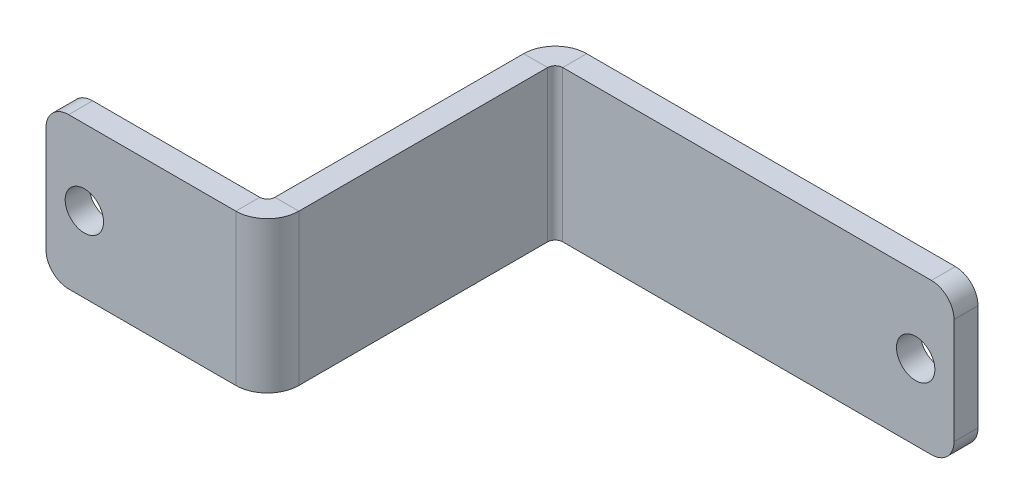
from build123d import *

# Parameters (mm, degrees)
SKETCH1_W                    = 26.140328994
SKETCH1_H                    = 20
BASE_FLANGE1_DEPTH           = 3.175
EDGE_FLANGE1_STRIP_W         = 14.7
EDGE_FLANGE1_STRIP_H         = 3.175
EDGE_FLANGE1_STRIP_CUT_DEPTH = 20
EDGE_FLANGE1_DEPTH           = 20
EDGE_FLANGE2_STRIP_W         = 14.7
EDGE_FLANGE2_STRIP_H         = 3.175
EDGE_FLANGE2_STRIP_CUT_DEPTH = 20
EDGE_FLANGE2_DEPTH           = 20
FILLET1_R                    = 3
SKETCH18_R                   = 2.54
CUT_EXTRUDE2_DEPTH           = 360.816616057
SKETCH19_R                   = 2.54
CUT_EXTRUDE3_DEPTH           = 360.466065193


# Sheet-metal steps are written as plain solids
with BuildPart() as part:
    # Sketch1 → Base-Flange1 (new body)
    with BuildSketch(Plane.XY.offset(-1949.683434301)):
        with Locations((87.899449082, 311.128054742)):
            Rectangle(SKETCH1_W, SKETCH1_H)
    extrude(amount=BASE_FLANGE1_DEPTH)

    # Edge-Flange1 strip (across the edge) → Edge-Flange1 strip cut (cut)
    with BuildSketch(Plane(origin=(100.969613579, 321.128054742, -1949.683434301), x_dir=(-1, 0, 0), z_dir=(0, -1, 0))):
        with Locations((-6.35, -1.5875)):
            Rectangle(EDGE_FLANGE1_STRIP_W, EDGE_FLANGE1_STRIP_H)
    extrude(amount=EDGE_FLANGE1_STRIP_CUT_DEPTH, mode=Mode.SUBTRACT)

    # Edge-Flange1 section (across the edge) → Edge-Flange1 (add)
    with BuildSketch(Plane(origin=(100.969613579, 321.128054742, -1949.683434301), x_dir=(-1, 0, 0), z_dir=(0, -1, 0))):
        with BuildLine():
            Line((-3.175, 1), (-3.175, 34.9454))
            Line((-3.175, 34.9454), (0, 34.9454))
            Line((0, 34.9454), (0, 1))
            ThreePointArc((0, 1), (0.292893219, 0.292893219), (1, 0))
            Line((1, 0), (1, -3.175))
            ThreePointArc((1, -3.175), (-1.952170811, -1.952170811), (-3.175, 1))
        make_face()
    extrude(amount=EDGE_FLANGE1_DEPTH)

    # Edge-Flange2 strip (across the edge) → Edge-Flange2 strip cut (cut)
    with BuildSketch(Plane(origin=(104.144613579, 301.128054742, -1984.628834301), x_dir=(0, 0, 1), z_dir=(0, 1, 0))):
        with Locations((-6.35, -1.5875)):
            Rectangle(EDGE_FLANGE2_STRIP_W, EDGE_FLANGE2_STRIP_H)
    extrude(amount=EDGE_FLANGE2_STRIP_CUT_DEPTH, mode=Mode.SUBTRACT)

    # Edge-Flange2 section (across the edge) → Edge-Flange2 (add)
    with BuildSketch(Plane(origin=(104.144613579, 301.128054742, -1984.628834301), x_dir=(0, 0, 1), z_dir=(0, 1, 0))):
        with BuildLine():
            Line((-3.175, 1), (-3.175, 52.825))
            Line((-3.175, 52.825), (0, 52.825))
            Line((0, 52.825), (0, 1))
            ThreePointArc((0, 1), (0.292893219, 0.292893219), (1, 0))
            Line((1, 0), (1, -3.175))
            ThreePointArc((1, -3.175), (-1.952170811, -1.952170811), (-3.175, 1))
        make_face()
    extrude(amount=EDGE_FLANGE2_DEPTH)

    # Fillet1
    fillet1_edges = [part.edges().sort_by_distance(p)[0] for p in [
        (156.969613579, 301.128054742, -1986.216334301),
        (156.969613579, 321.128054742, -1986.216334301),
        (74.829284585, 301.128054742, -1948.095934301),
        (74.829284585, 321.128054742, -1948.095934301),
    ]]
    fillet(fillet1_edges, radius=FILLET1_R)

    # Sketch18 → Cut-Extrude2 (cut, through all)
    with BuildSketch(Plane.XY.offset(-1946.508434301)):
        with Locations((79.909284585, 311.128054742)):
            Circle(SKETCH18_R)
    extrude(amount=-CUT_EXTRUDE2_DEPTH, mode=Mode.SUBTRACT)

    # Sketch19 → Cut-Extrude3 (cut, through all)
    with BuildSketch(Plane.XY.offset(-1984.628834301)):
        with Locations((151.889613579, 311.128054742)):
            Circle(SKETCH19_R)
    extrude(amount=-CUT_EXTRUDE3_DEPTH, mode=Mode.SUBTRACT)


solid = part.part
